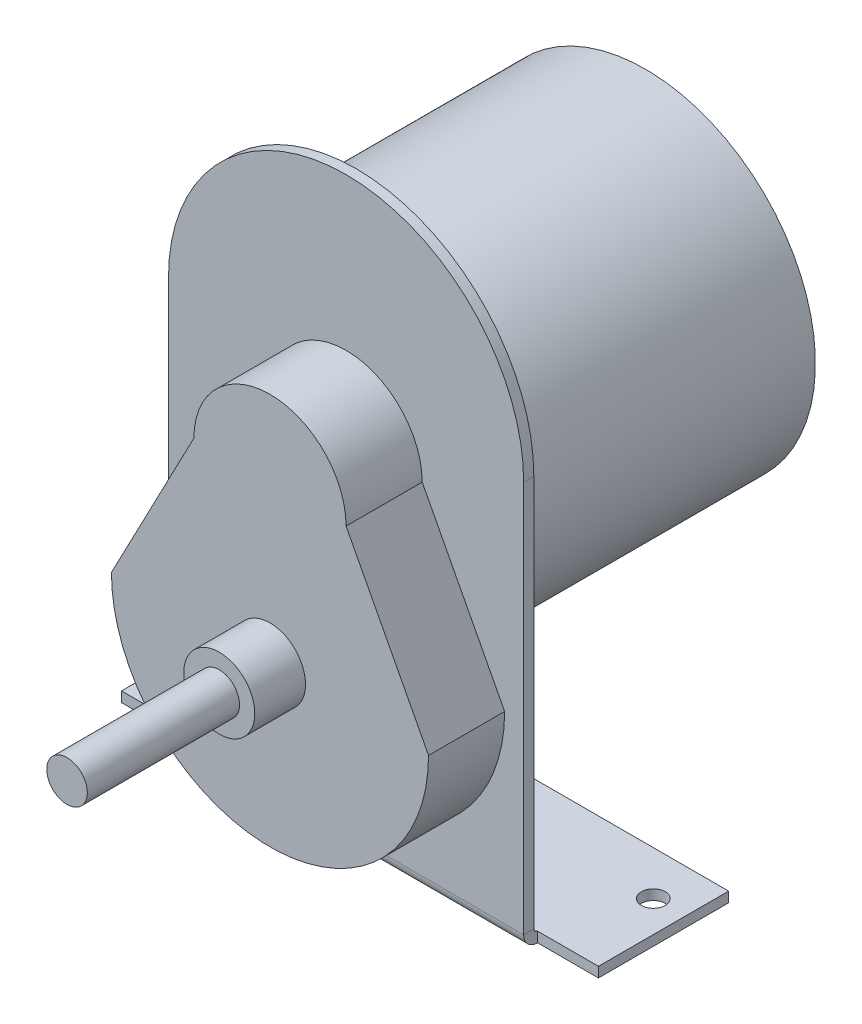
from build123d import *

# Parameters (mm, degrees)
SKETCH1_R                    = 33.5
BOSS_EXTRUDE1_DEPTH          = 57
BASE_FLANGE1_DEPTH           = 2
EDGE_FLANGE4_STRIP_W         = 9.4732
EDGE_FLANGE4_STRIP_H         = 2
EDGE_FLANGE4_STRIP_CUT_DEPTH = 70
EDGE_FLANGE4_DEPTH           = 70
EDGE_FLANGE4_PROFILE_W       = 94
EDGE_FLANGE4_PROFILE_H       = 25.6634
EDGE_FLANGE4_FLAT_DEPTH      = 2
BOSS_EXTRUDE5_DEPTH          = 15
SKETCH23_R                   = 7
BOSS_EXTRUDE6_DEPTH          = 10
SKETCH24_R                   = 4
BOSS_EXTRUDE7_DEPTH          = 30
SKETCH25_R                   = 2.35
CUT_EXTRUDE1_DEPTH           = 5


# Sheet-metal steps are written as plain solids
with BuildPart() as part:
    # Sketch1 → Boss-Extrude1 (new body)
    with BuildSketch(Plane.XY):
        with Locations(Location((0, 0, 0), (0, 0, 180))):
            Circle(SKETCH1_R)
    extrude(amount=BOSS_EXTRUDE1_DEPTH)


with BuildPart() as body_2:
    # Sketch2 → Base-Flange1 (new body)
    with BuildSketch(Plane.XY.offset(57)):
        with BuildLine():
            Line((-35, 10), (-35, -70))
            Line((-35, -70), (35, -70))
            Line((35, -70), (35, 10))
            ThreePointArc((35, 10), (0, 45), (-35, 10))
        make_face()
    extrude(amount=BASE_FLANGE1_DEPTH)

    # Edge-Flange4 strip (across the edge) → Edge-Flange4 strip cut (cut)
    with BuildSketch(Plane(origin=(35, -70, 57), x_dir=(0, 1, 0), z_dir=(-1, 0, 0))):
        with Locations((-2, -1)):
            Rectangle(EDGE_FLANGE4_STRIP_W, EDGE_FLANGE4_STRIP_H)
    extrude(amount=EDGE_FLANGE4_STRIP_CUT_DEPTH, mode=Mode.SUBTRACT)

    # Edge-Flange4 bend section (across the edge) → Edge-Flange4 (add)
    with BuildSketch(Plane(origin=(35, -70, 57), x_dir=(0, 1, 0), z_dir=(-1, 0, 0))):
        with BuildLine():
            Line((0, 0.7366), (2, 0.7366))
            ThreePointArc((2, 0.7366), (2.215745145, 0.215745145), (2.7366, 0))
            Line((2.7366, 0), (2.7366, -2))
            ThreePointArc((2.7366, -2), (0.801531583, -1.198468417), (0, 0.7366))
        make_face()
    extrude(amount=EDGE_FLANGE4_DEPTH)

    # Edge-Flange4 profile (on flange) → Edge-Flange4 flat (add)
    with BuildSketch(Plane(origin=(0, -70, 57), x_dir=(-1, 0, 0), z_dir=(0, -1, 0))):
        with Locations((0, 13.5683)):
            Rectangle(EDGE_FLANGE4_PROFILE_W, EDGE_FLANGE4_PROFILE_H)
    extrude(amount=-EDGE_FLANGE4_FLAT_DEPTH)

    # Sketch12 → Boss-Extrude5 (add)
    with BuildSketch(Plane.XY.offset(59)):
        with BuildLine():
            Line((-31.25, -31.0134), (-15, 0))
            ThreePointArc((-15, 0), (0, 15), (15, 0))
            Line((15, 0), (31.25, -31.0134))
            ThreePointArc((31.25, -31.0134), (0, -62.2634), (-31.25, -31.0134))
        make_face()
    extrude(amount=BOSS_EXTRUDE5_DEPTH)

    # Sketch23 → Boss-Extrude6 (add)
    with BuildSketch(Plane.XY.offset(74)):
        with Locations((0, -31.0134)):
            Circle(SKETCH23_R)
    extrude(amount=BOSS_EXTRUDE6_DEPTH)

    # Sketch24 → Boss-Extrude7 (add)
    with BuildSketch(Plane.XY.offset(84)):
        with Locations((0, -31.0134)):
            Circle(SKETCH24_R)
    extrude(amount=BOSS_EXTRUDE7_DEPTH)

    # Sketch25 → Cut-Extrude1 (cut)
    with BuildSketch(Plane.XZ.offset(70)):
        with Locations(Location((40.85, 39.3, 0), (0, 0, 270))):
            Circle(SKETCH25_R)
        with Locations(Location((-40.85, 39.3, 0), (0, 0, 270))):
            Circle(SKETCH25_R)
    extrude(amount=-CUT_EXTRUDE1_DEPTH, mode=Mode.SUBTRACT)


solid = Compound([part.part, body_2.part])
